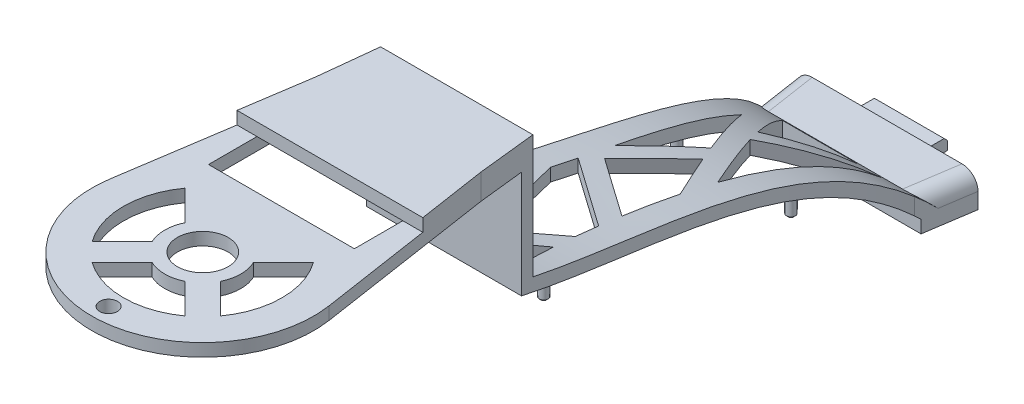
from build123d import *

# Parameters (mm, degrees)
EXTRUDE_3_DEPTH     = 35
EXTRUDE_4_REACH     = 138.001
SKETCH_3_W          = 35
SKETCH_3_H          = 5
CUT_EXTRUDE_1_REACH = 138.588
SKETCH_4_W          = 23
SKETCH_4_H          = 20
SKETCH_6_W          = 35
SKETCH_6_H          = 20
EXTRUDE_5_DEPTH     = 2
CUT_EXTRUDE_START   = -43
SKETCH_5_W          = 37
SKETCH_5_H          = 167
CUT_EXTRUDE_3_DEPTH = 43
CUT_EXTRUDE_4_REACH = 138.588
SKETCH_7_R          = 4
CUT_EXTRUDE_5_REACH = 138.588
FILLET_1_R          = 2.5
SKETCH_9_W          = 11
SKETCH_9_H          = 1.9
EXTRUDE_6_DEPTH     = 4
CHAMFER_1_SIZE      = 0.5
EXTRUDE_7_REACH     = 142.87
SKETCH_10_R         = 0.7
SKETCH_11_W         = 1.4
SKETCH_11_H         = 17.763423597
SKETCH_11_H_2       = 8.613891415
CUT_EXTRUDE_6_DEPTH = 141.272057143
CHAMFER_2_SIZE      = 0.3
CUT_EXTRUDE_7_REACH = 142.272
SKETCH_12_R         = 1.4


with BuildPart() as part:
    # 스케치1 → 보스-돌출3 (new body)
    with BuildSketch(Plane(origin=(0, 0, 0), x_dir=(0, 0, -1), z_dir=(1, 0, 0))):
        with BuildLine():
            Line((0, 39), (0, 37))
            Line((0, 37), (26.725263459, 37))
            add(Edge.make_bspline(
                [(26.725263459, 37), (26.148278539, 37.655276088), (25.597696539, 38.322441812), (25.074566193, 39)],
                knots=[0.77664627, 0.77664627, 0.77664627, 0.77664627, 0.80066841, 0.80066841, 0.80066841, 0.80066841], degree=3))
            Line((25.074566193, 39), (0, 39))
        make_face()
        with BuildLine():
            add(Edge.make_bspline(
                [(26.725263459, 37), (26.148278539, 37.655276088), (25.597696539, 38.322441812), (25.074566193, 39)],
                knots=[0.77664627, 0.77664627, 0.77664627, 0.77664627, 0.80066841, 0.80066841, 0.80066841, 0.80066841], degree=3))
            Line((26.725263459, 37), (29.444495441, 37))
            add(Edge.make_bspline(
                [(29.444495441, 37), (28.971944644, 37.490598626), (28.513995445, 37.987732563), (28.070940561, 38.49101771), (27.643058705, 39)],
                knots=[0.759457651, 0.759457651, 0.759457651, 0.759457651, 0.759457651, 0.785298921, 0.785298921, 0.785298921, 0.785298921, 0.785298921], degree=4))
            Line((27.643058705, 39), (25.074566193, 39))
        make_face()
        with BuildLine():
            Line((55.643058705, 37), (55.643058705, 22.181452855))
            add(Edge.make_bspline(
                [(57.643058705, 21.582835877), (57.139082637, 21.728542293), (56.637689621, 21.87682745), (56.138981644, 22.02777355), (55.643058705, 22.181452855)],
                knots=[0.486406512, 0.486406512, 0.486406512, 0.486406512, 0.486406512, 0.502272255, 0.502272255, 0.502272255, 0.502272255, 0.502272255], degree=4))
            Line((57.643058705, 21.582835877), (57.643058705, 37))
            Line((57.643058705, 37), (57.643058705, 39))
            Line((57.643058705, 39), (27.643058705, 39))
            add(Edge.make_bspline(
                [(29.444495441, 37), (28.971944644, 37.490598626), (28.513995445, 37.987732563), (28.070940561, 38.49101771), (27.643058705, 39)],
                knots=[0.759457651, 0.759457651, 0.759457651, 0.759457651, 0.759457651, 0.785298921, 0.785298921, 0.785298921, 0.785298921, 0.785298921], degree=4))
            Line((29.444495441, 37), (55.643058705, 37))
        make_face()
        with BuildLine():
            Line((55.643058705, 22.181452855), (55.643058705, 20.089505297))
            add(Edge.make_bspline(
                [(57.643058705, 19.502971746), (56.971875042, 19.69320396), (56.305067989, 19.88856897), (55.643058705, 20.089505297)],
                knots=[0.482118661, 0.482118661, 0.482118661, 0.482118661, 0.497636496, 0.497636496, 0.497636496, 0.497636496], degree=3))
            Line((57.643058705, 19.502971746), (57.643058705, 21.582835877))
            add(Edge.make_bspline(
                [(57.643058705, 21.582835877), (57.139082637, 21.728542293), (56.637689621, 21.87682745), (56.138981644, 22.02777355), (55.643058705, 22.181452855)],
                knots=[0.486406512, 0.486406512, 0.486406512, 0.486406512, 0.486406512, 0.502272255, 0.502272255, 0.502272255, 0.502272255, 0.502272255], degree=4))
        make_face()
        with BuildLine():
            add(Edge.make_bspline(
                [(117.699360548, 0), (117.586128769, 0.109352375), (117.016175939, 0.652379044), (115.388137002, 2.102350503), (112.694389193, 4.120676414), (109.18426439, 6.212083918), (104.249768624, 8.570132087), (97.662243886, 10.840526866), (86.501645197, 13.533255144), (72.767797603, 15.874270502), (62.276198429, 18.189810418), (57.643058705, 19.502971746)],
                knots=[0.013863379, 0.013863379, 0.013863379, 0.013863379, 0.017329223, 0.03125, 0.0625, 0.09375, 0.125, 0.1875, 0.25, 0.375, 0.482118661, 0.482118661, 0.482118661, 0.482118661], degree=3))
            Line((117.699360548, 0), (117.699360548, -2))
            Line((117.699360548, -2), (125.5, -2))
            Line((125.5, -2), (125.5, 0))
            Line((125.5, 0), (120.5, 0))
            add(Edge.make_bspline(
                [(120.5, 0), (108.339837196, 13.084335177), (90.972299987, 15.072538615), (73.093784671, 17.115818385), (57.643058705, 21.582835877)],
                knots=[0, 0, 0, 0, 0, 0.486406512, 0.486406512, 0.486406512, 0.486406512, 0.486406512], degree=4))
            Line((57.643058705, 21.582835877), (57.643058705, 19.502971746))
        make_face()
    extrude(amount=EXTRUDE_3_DEPTH)

    # 스케치3 → 보스-돌출4 (add, up to next)
    with BuildSketch(Plane(origin=(0, 0, -125.5), x_dir=(-1, 0, 0), z_dir=(0, 0, -1)), mode=Mode.PRIVATE) as extrude_4_sk1:
        with Locations((-17.5, 0.5)):
            Rectangle(SKETCH_3_W, SKETCH_3_H)
    extrude_4_tool1 = extrude(extrude_4_sk1.sketch, amount=-EXTRUDE_4_REACH, mode=Mode.PRIVATE) - part.part
    add(extrude_4_tool1.solids().sort_by_distance((17.5, 0.5, -125.5))[0])

    # 스케치4 → 컷-돌출1 (cut, up to next)
    with BuildSketch(Plane(origin=(0, 39, 0), x_dir=(1, 0, 0), z_dir=(0, 1, 0)), mode=Mode.PRIVATE) as cut_extrude_1_sk1:
        with Locations((17.5, 40)):
            Rectangle(SKETCH_4_W, SKETCH_4_H)
    cut_extrude_1_tool1 = extrude(cut_extrude_1_sk1.sketch, amount=-CUT_EXTRUDE_1_REACH, mode=Mode.PRIVATE) & part.part
    add(cut_extrude_1_tool1.solids().sort_by_distance((17.5, 39, -40))[0], mode=Mode.SUBTRACT)

    # 스케치6 → 보스-돌출5 (add)
    with BuildSketch(Plane(origin=(0, 39, 0), x_dir=(1, 0, 0), z_dir=(0, 1, 0))):
        with Locations((17.5, 47.643058705)):
            Rectangle(SKETCH_6_W, SKETCH_6_H)
    extrude(amount=EXTRUDE_5_DEPTH)

    # 스케치5 → 컷-돌출3 (cut)
    with BuildSketch(Plane(origin=(0, 41, 0), x_dir=(1, 0, 0), z_dir=(0, 1, 0)).offset(CUT_EXTRUDE_START)):
        with Locations((17.5, 82.593283743)):
            Rectangle(SKETCH_5_W, SKETCH_5_H)
        with BuildLine():
            Line((30.522393477, 116.828379806), (34.801062462, 144.962079133))
            ThreePointArc((34.801062462, 144.962079133), (17.5, 165.093283743), (0.198937538, 144.962079133))
            Line((0.198937538, 144.962079133), (4.477606523, 116.828379806))
            add(Edge.make_bspline(
                [(4.477606523, 116.828379806), (4.651050422, 116.260512881), (4.969399641, 115.134014291), (5.554029222, 112.724632932), (6.162921155, 109.518137346), (6.718180461, 105.35964565), (7.236717161, 99.459203145), (7.500027556, 91.513937123), (7.309155883, 81.478769093), (6.836552559, 73.122643152), (6.347084175, 66.745324225), (5.945866846, 62.201927265), (5.53318653, 57.988401314), (5.19987871, 54.832311537), (4.952506682, 52.572535506), (4.779849873, 51.022546803), (4.650059532, 49.867537731), (4.555377149, 49.023033468), (4.513252567, 48.64516442), (4.491671129, 48.450667229)],
                knots=[-0.000557266, -0.000557266, -0.000557266, -0.000557266, 0.030668618, 0.061894501, 0.124346268, 0.186798035, 0.249249802, 0.374153336, 0.49905687, 0.623960403, 0.68641217, 0.748863937, 0.811315704, 0.873767471, 0.904993354, 0.936219238, 0.967445121, 0.983058063, 0.998671005, 0.998671005, 0.998671005, 0.998671005], degree=3))
            Line((4.491671129, 48.450667229), (0.198937538, 20.224488353))
            ThreePointArc((0.198937538, 20.224488353), (17.5, 0.093283743), (34.801062462, 20.224488353))
            Line((34.801062462, 20.224488353), (30.508328871, 48.450667229))
            add(Edge.make_bspline(
                [(30.508328871, 48.450667229), (30.486747433, 48.64516442), (30.444622851, 49.023033468), (30.349940468, 49.867537731), (30.220150127, 51.022546803), (30.047493318, 52.572535506), (29.80012129, 54.832311537), (29.46681347, 57.988401314), (29.054133154, 62.201927265), (28.652915825, 66.745324225), (28.163447441, 73.122643152), (27.690844117, 81.478769093), (27.499972444, 91.513937123), (27.763282839, 99.459203145), (28.281819539, 105.35964565), (28.837078845, 109.518137346), (29.445970778, 112.724632932), (30.030600359, 115.134014291), (30.348949578, 116.260512881), (30.522393477, 116.828379806)],
                knots=[-0.000557266, -0.000557266, -0.000557266, -0.000557266, 0.015055676, 0.030668618, 0.061894501, 0.093120385, 0.124346268, 0.186798035, 0.249249802, 0.311701569, 0.374153336, 0.49905687, 0.623960403, 0.748863937, 0.811315704, 0.873767471, 0.936219238, 0.967445121, 0.998671005, 0.998671005, 0.998671005, 0.998671005], degree=3))
        make_face(mode=Mode.SUBTRACT)
    extrude(amount=CUT_EXTRUDE_3_DEPTH, mode=Mode.SUBTRACT)

    # 스케치7 → 컷-돌출4 (cut, up to next)
    with BuildSketch(Plane(origin=(0, 39, 0), x_dir=(1, 0, 0), z_dir=(0, 1, 0)), mode=Mode.PRIVATE) as cut_extrude_4_sk1:
        with Locations(Location((17.5, 17.593283743, 0), (0, 0, 270))):
            Circle(SKETCH_7_R)
    cut_extrude_4_tool1 = extrude(cut_extrude_4_sk1.sketch, amount=-CUT_EXTRUDE_4_REACH, mode=Mode.PRIVATE) & part.part
    # 스케치7 → 컷-돌출4 (cut, up to next)
    with BuildSketch(Plane(origin=(0, 39, 0), x_dir=(1, 0, 0), z_dir=(0, 1, 0)), mode=Mode.PRIVATE) as cut_extrude_4_sk2:
        with BuildLine():
            Line((20.085786438, 12.179070181), (24.810750621, 7.454105997))
            ThreePointArc((24.810750621, 7.454105997), (17.5, 5.093283743), (10.189249379, 7.454105997))
            Line((10.189249379, 7.454105997), (14.914213562, 12.179070181))
            ThreePointArc((14.914213562, 12.179070181), (17.5, 11.593283743), (20.085786438, 12.179070181))
        make_face()
    cut_extrude_4_tool2 = extrude(cut_extrude_4_sk2.sketch, amount=-CUT_EXTRUDE_4_REACH, mode=Mode.PRIVATE) & part.part
    # 스케치7 → 컷-돌출4 (cut, up to next)
    with BuildSketch(Plane(origin=(0, 39, 0), x_dir=(1, 0, 0), z_dir=(0, 1, 0)), mode=Mode.PRIVATE) as cut_extrude_4_sk3:
        with BuildLine():
            Line((12.085786438, 15.007497305), (7.360822254, 10.282533122))
            ThreePointArc((7.360822254, 10.282533122), (5, 17.593283743), (7.360822254, 24.904034364))
            Line((7.360822254, 24.904034364), (12.085786438, 20.179070181))
            ThreePointArc((12.085786438, 20.179070181), (11.5, 17.593283743), (12.085786438, 15.007497305))
        make_face()
    cut_extrude_4_tool3 = extrude(cut_extrude_4_sk3.sketch, amount=-CUT_EXTRUDE_4_REACH, mode=Mode.PRIVATE) & part.part
    # 스케치7 → 컷-돌출4 (cut, up to next)
    with BuildSketch(Plane(origin=(0, 39, 0), x_dir=(1, 0, 0), z_dir=(0, 1, 0)), mode=Mode.PRIVATE) as cut_extrude_4_sk4:
        with BuildLine():
            Line((22.914213562, 15.007497305), (27.639177746, 10.282533122))
            ThreePointArc((27.639177746, 10.282533122), (30, 17.593283743), (27.639177746, 24.904034364))
            Line((27.639177746, 24.904034364), (22.914213562, 20.179070181))
            ThreePointArc((22.914213562, 20.179070181), (23.5, 17.593283743), (22.914213562, 15.007497305))
        make_face()
    cut_extrude_4_tool4 = extrude(cut_extrude_4_sk4.sketch, amount=-CUT_EXTRUDE_4_REACH, mode=Mode.PRIVATE) & part.part
    add(cut_extrude_4_tool1.solids().sort_by_distance((17.5, 39, -17.593284))[0], mode=Mode.SUBTRACT)
    add(cut_extrude_4_tool2.solids().sort_by_distance((17.5, 39, -8.353771))[0], mode=Mode.SUBTRACT)
    add(cut_extrude_4_tool3.solids().sort_by_distance((8.260488, 39, -17.593284))[0], mode=Mode.SUBTRACT)
    add(cut_extrude_4_tool4.solids().sort_by_distance((26.739512, 39, -17.593284))[0], mode=Mode.SUBTRACT)

    # 스케치8 → 컷-돌출5 (cut, up to next)
    with BuildSketch(Plane(origin=(0, 39, 0), x_dir=(1, 0, 0), z_dir=(0, 1, 0)), mode=Mode.PRIVATE) as cut_extrude_5_sk1:
        with BuildLine():
            Line((16.691502182, 104.732545374), (25.292030642, 116.828379802))
            add(Edge.make_bspline(
                [(25.292030642, 116.828379802), (25.077721967, 114.636634515), (24.862923743, 112.288888308), (24.461300149, 107.39576934), (24.274472871, 104.85018989), (23.955656342, 99.665620607), (23.823408842, 97.025461811), (23.710118122, 93.801254712), (23.691564688, 93.21882818), (23.675035447, 92.636710943)],
                knots=[0, 0, 0, 0, 0.125, 0.125, 0.25, 0.25, 0.375, 0.375, 0.402552863, 0.402552863, 0.402552863, 0.402552863], degree=3))
            Line((23.675035447, 92.636710943), (16.691502182, 104.732545374))
        make_face()
    cut_extrude_5_tool1 = extrude(cut_extrude_5_sk1.sketch, amount=-CUT_EXTRUDE_5_REACH, mode=Mode.PRIVATE) & part.part
    # 스케치8 → 컷-돌출5 (cut, up to next)
    with BuildSketch(Plane(origin=(0, 39, 0), x_dir=(1, 0, 0), z_dir=(0, 1, 0)), mode=Mode.PRIVATE) as cut_extrude_5_sk2:
        Polygon((15.04195088, 107.589652038), (21.610984295, 116.828379806), (9.707968917, 116.828379806), align=None)
    cut_extrude_5_tool2 = extrude(cut_extrude_5_sk2.sketch, amount=-CUT_EXTRUDE_5_REACH, mode=Mode.PRIVATE) & part.part
    # 스케치8 → 컷-돌출5 (cut, up to next)
    with BuildSketch(Plane(origin=(0, 39, 0), x_dir=(1, 0, 0), z_dir=(0, 1, 0)), mode=Mode.PRIVATE) as cut_extrude_5_sk3:
        with BuildLine():
            Line((15.505845235, 59.593278961), (10.774153845, 71.696642653))
            add(Edge.make_bspline(
                [(8.64344584, 59.593278961), (9.10181068, 61.244648559), (9.491182934, 62.980533534), (10.21158977, 66.934682025), (10.519484145, 69.184915406), (10.762825325, 71.583605341), (10.768509949, 71.640097223), (10.774153845, 71.696642653)],
                knots=[0.019058547, 0.019058547, 0.019058547, 0.019058547, 0.125, 0.125, 0.25, 0.25, 0.253011951, 0.253011951, 0.253011951, 0.253011951], degree=3))
            Line((8.64344584, 59.593278961), (15.505845235, 59.593278961))
        make_face()
    cut_extrude_5_tool3 = extrude(cut_extrude_5_sk3.sketch, amount=-CUT_EXTRUDE_5_REACH, mode=Mode.PRIVATE) & part.part
    # 스케치8 → 컷-돌출5 (cut, up to next)
    with BuildSketch(Plane(origin=(0, 39, 0), x_dir=(1, 0, 0), z_dir=(0, 1, 0)), mode=Mode.PRIVATE) as cut_extrude_5_sk4:
        with BuildLine():
            Line((18.054031396, 61.314558592), (11.263582544, 78.684092088))
            add(Edge.make_bspline(
                [(11.263582544, 78.684092088), (11.265377905, 78.72529828), (11.325270905, 80.113237585), (11.366646606, 81.52198269), (11.390908363, 82.903708206)],
                knots=[0.372940531, 0.372940531, 0.372940531, 0.372940531, 0.375, 0.442277722, 0.442277722, 0.442277722, 0.442277722], degree=3))
            Line((11.390908363, 82.903708206), (24.065009863, 73.451540683))
            add(Edge.make_bspline(
                [(24.065009863, 73.451540683), (24.098531765, 73.051223451), (24.133949977, 72.653334848), (24.264156198, 71.275598828), (24.368974648, 70.308763614), (24.486602245, 69.358821631)],
                knots=[0.730442032, 0.730442032, 0.730442032, 0.730442032, 0.75, 0.75, 0.798600961, 0.798600961, 0.798600961, 0.798600961], degree=3))
            Line((24.486602245, 69.358821631), (18.054031396, 61.314558592))
        make_face()
    cut_extrude_5_tool4 = extrude(cut_extrude_5_sk4.sketch, amount=-CUT_EXTRUDE_5_REACH, mode=Mode.PRIVATE) & part.part
    # 스케치8 → 컷-돌출5 (cut, up to next)
    with BuildSketch(Plane(origin=(0, 39, 0), x_dir=(1, 0, 0), z_dir=(0, 1, 0)), mode=Mode.PRIVATE) as cut_extrude_5_sk5:
        with BuildLine():
            Line((10.347912797, 109.71996446), (16.964650648, 98.259438322))
            Line((16.964650648, 98.259438322), (11.405472996, 88.630660182))
            add(Edge.make_bspline(
                [(11.405472996, 88.630660182), (11.383674812, 90.539635883), (11.336935073, 92.462134929), (11.17659092, 97.025461833), (11.044343391, 99.665620628), (10.728182613, 104.807001344), (10.544917131, 107.31093552), (10.347912797, 109.71996446)],
                knots=[0.53408689, 0.53408689, 0.53408689, 0.53408689, 0.625, 0.625, 0.75, 0.75, 0.872917447, 0.872917447, 0.872917447, 0.872917447], degree=3))
        make_face()
    cut_extrude_5_tool5 = extrude(cut_extrude_5_sk5.sketch, amount=-CUT_EXTRUDE_5_REACH, mode=Mode.PRIVATE) & part.part
    # 스케치8 → 컷-돌출5 (cut, up to next)
    with BuildSketch(Plane(origin=(0, 39, 0), x_dir=(1, 0, 0), z_dir=(0, 1, 0)), mode=Mode.PRIVATE) as cut_extrude_5_sk6:
        with BuildLine():
            Line((18.696701455, 95.259438322), (13.02164661, 85.429954994))
            Line((13.02164661, 85.429954994), (23.798426283, 77.392783535))
            add(Edge.make_bspline(
                [(23.581388498, 86.798912185), (23.581096793, 86.695847742), (23.580882505, 86.592836907), (23.577296107, 83.881916209), (23.624098242, 81.311040461), (23.751344692, 78.333602698), (23.773770314, 77.861885966), (23.798426283, 77.392783535)],
                knots=[0.495065364, 0.495065364, 0.495065364, 0.495065364, 0.5, 0.5, 0.625, 0.625, 0.648677177, 0.648677177, 0.648677177, 0.648677177], degree=3))
            Line((23.581388498, 86.798912185), (18.696701455, 95.259438322))
        make_face()
    cut_extrude_5_tool6 = extrude(cut_extrude_5_sk6.sketch, amount=-CUT_EXTRUDE_5_REACH, mode=Mode.PRIVATE) & part.part
    # 스케치8 → 컷-돌출5 (cut, up to next)
    with BuildSketch(Plane(origin=(0, 39, 0), x_dir=(1, 0, 0), z_dir=(0, 1, 0)), mode=Mode.PRIVATE) as cut_extrude_5_sk7:
        with BuildLine():
            Line((20.518828382, 59.593278961), (25.087047693, 65.306073831))
            add(Edge.make_bspline(
                [(25.087047693, 65.306073831), (25.116965553, 65.134845346), (25.147394212, 64.964300679), (25.508817031, 62.980533516), (25.898189298, 61.24464855), (26.356554151, 59.593278961)],
                knots=[0.865079827, 0.865079827, 0.865079827, 0.865079827, 0.875, 0.875, 0.980941453, 0.980941453, 0.980941453, 0.980941453], degree=3))
            Line((26.356554151, 59.593278961), (20.518828382, 59.593278961))
        make_face()
    cut_extrude_5_tool7 = extrude(cut_extrude_5_sk7.sketch, amount=-CUT_EXTRUDE_5_REACH, mode=Mode.PRIVATE) & part.part
    add(cut_extrude_5_tool1.solids().sort_by_distance((21.794139, 39, -104.74214))[0], mode=Mode.SUBTRACT)
    add(cut_extrude_5_tool2.solids().sort_by_distance((15.453635, 39, -113.748804))[0], mode=Mode.SUBTRACT)
    add(cut_extrude_5_tool3.solids().sort_by_distance((11.741489, 39, -63.52807))[0], mode=Mode.SUBTRACT)
    add(cut_extrude_5_tool4.solids().sort_by_distance((17.828553, 39, -72.258316))[0], mode=Mode.SUBTRACT)
    add(cut_extrude_5_tool5.solids().sort_by_distance((12.98819, 39, -98.866116))[0], mode=Mode.SUBTRACT)
    add(cut_extrude_5_tool6.solids().sort_by_distance((19.280935, 39, -86.147362))[0], mode=Mode.SUBTRACT)
    add(cut_extrude_5_tool7.solids().sort_by_distance((23.958371, 39, -61.482125))[0], mode=Mode.SUBTRACT)

    # 필렛1
    fillet_1_edges = [part.edges().sort_by_distance(p)[0] for p in [
        (31.22283459, 3, -121.434017623),
        (3.77716541, 3, -121.434017623),
    ]]
    fillet(fillet_1_edges, radius=FILLET_1_R)

    # 스케치9 → 보스-돌출6 (add)
    with BuildSketch(Plane(origin=(0, 0, -125.5), x_dir=(-1, 0, 0), z_dir=(0, 0, -1))):
        with Locations((-17.5, 0.6)):
            Rectangle(SKETCH_9_W, SKETCH_9_H)
    extrude(amount=EXTRUDE_6_DEPTH)

    # 모따기1
    chamfer_1_edges = [part.edges().sort_by_distance(p)[0] for p in [
        (17.5, 1.55, -129.5),
    ]]
    chamfer(chamfer_1_edges, length=CHAMFER_1_SIZE)

    # 스케치10 → 보스-돌출7 (add, up to next)
    with BuildSketch(Plane.XZ.offset(2), mode=Mode.PRIVATE) as extrude_7_sk1:
        with Locations(Location((7.5, -61.349360548, 0), (0, 0, 270))):
            Circle(SKETCH_10_R)
    extrude_7_tool1 = extrude(extrude_7_sk1.sketch, amount=-EXTRUDE_7_REACH, mode=Mode.PRIVATE) - part.part
    # 스케치10 → 보스-돌출7 (add, up to next)
    with BuildSketch(Plane.XZ.offset(2), mode=Mode.PRIVATE) as extrude_7_sk2:
        with Locations(Location((27.5, -61.349360548, 0), (0, 0, 270))):
            Circle(SKETCH_10_R)
    extrude_7_tool2 = extrude(extrude_7_sk2.sketch, amount=-EXTRUDE_7_REACH, mode=Mode.PRIVATE) - part.part
    # 스케치10 → 보스-돌출7 (add, up to next)
    with BuildSketch(Plane.XZ.offset(2), mode=Mode.PRIVATE) as extrude_7_sk3:
        with Locations(Location((8.5, -101.349360548, 0), (0, 0, 270))):
            Circle(SKETCH_10_R)
    extrude_7_tool3 = extrude(extrude_7_sk3.sketch, amount=-EXTRUDE_7_REACH, mode=Mode.PRIVATE) - part.part
    # 스케치10 → 보스-돌출7 (add, up to next)
    with BuildSketch(Plane.XZ.offset(2), mode=Mode.PRIVATE) as extrude_7_sk4:
        with Locations(Location((26.5, -101.349360548, 0), (0, 0, 270))):
            Circle(SKETCH_10_R)
    extrude_7_tool4 = extrude(extrude_7_sk4.sketch, amount=-EXTRUDE_7_REACH, mode=Mode.PRIVATE) - part.part
    add(extrude_7_tool1.solids().sort_by_distance((7.5, -2, -61.349361))[0])
    add(extrude_7_tool2.solids().sort_by_distance((27.5, -2, -61.349361))[0])
    add(extrude_7_tool3.solids().sort_by_distance((8.5, -2, -101.349361))[0])
    add(extrude_7_tool4.solids().sort_by_distance((26.5, -2, -101.349361))[0])

    # 스케치11 → 컷-돌출6 (cut, through all)
    with BuildSketch(Plane(origin=(0, 0, 0), x_dir=(0, 0, -1), z_dir=(1, 0, 0))):
        with Locations((61.349360548, 6.881711799)):
            Rectangle(SKETCH_11_W, SKETCH_11_H)
        with Locations((101.349360548, 2.306945708)):
            Rectangle(SKETCH_11_W, SKETCH_11_H_2)
    extrude(amount=CUT_EXTRUDE_6_DEPTH, mode=Mode.SUBTRACT)

    # 모따기2
    chamfer_2_edges = [part.edges().sort_by_distance(p)[0] for p in [
        (26.5, 6.613891415, -100.649360548),
        (27.5, 15.763423597, -60.649360548),
        (7.5, 15.763423597, -60.649360548),
        (8.5, 6.613891415, -100.649360548),
    ]]
    chamfer(chamfer_2_edges, length=CHAMFER_2_SIZE)

    # 스케치12 → 컷-돌출7 (cut, up to next)
    with BuildSketch(Plane(origin=(0, 39, 0), x_dir=(1, 0, 0), z_dir=(0, 1, 0)), mode=Mode.PRIVATE) as cut_extrude_7_sk1:
        with Locations(Location((17.5, 2.743283743, 0), (0, 0, 270))):
            Circle(SKETCH_12_R)
    cut_extrude_7_tool1 = extrude(cut_extrude_7_sk1.sketch, amount=-CUT_EXTRUDE_7_REACH, mode=Mode.PRIVATE) & part.part
    add(cut_extrude_7_tool1.solids().sort_by_distance((17.5, 39, -2.743284))[0], mode=Mode.SUBTRACT)


solid = part.part
